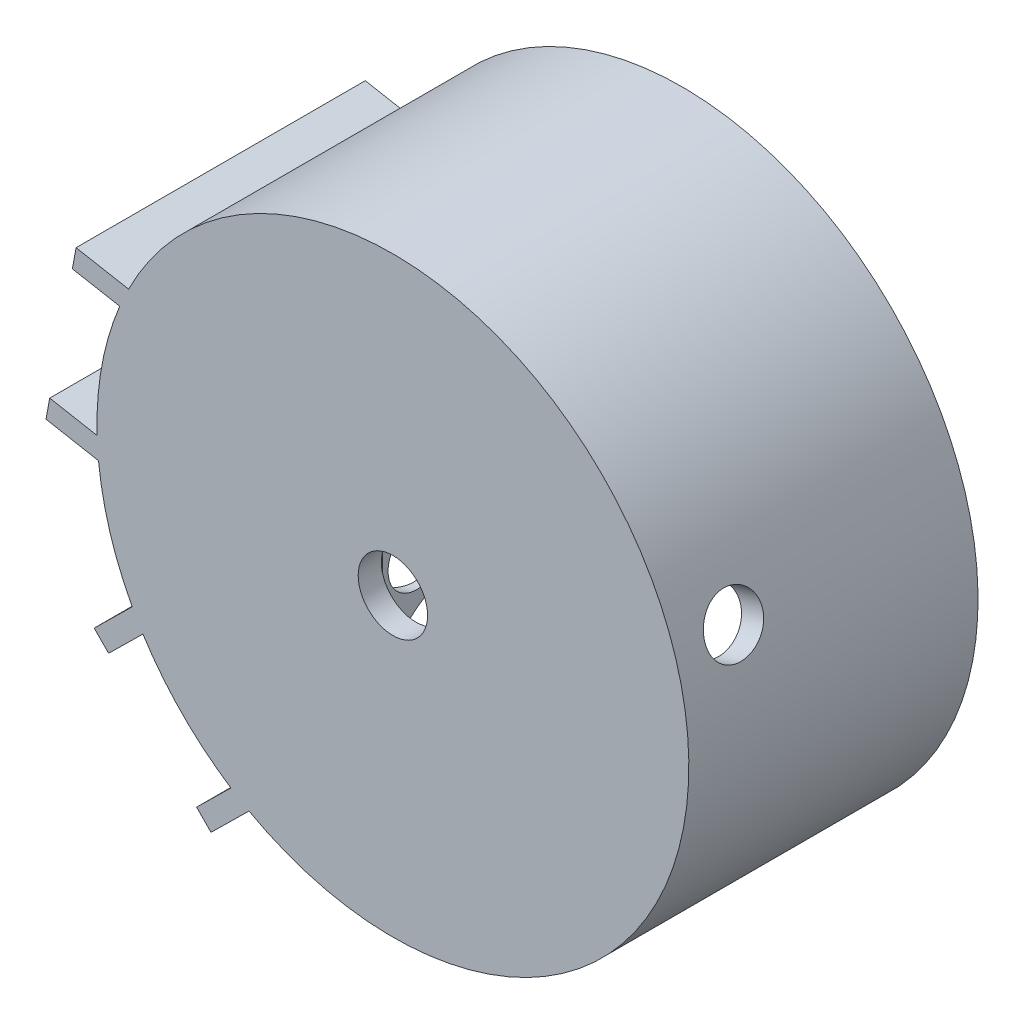
from build123d import *

# Parameters (mm, degrees)
SKETCH1_R                = 14.15
SKETCH1_R_2              = 1.8
BOSS_EXTRUDE1_DEPTH      = 1.2
BOSS_EXTRUDE2_START      = -15
SKETCH3_R                = 15.35
SKETCH3_R_2              = 14.15
BOSS_EXTRUDE2_DEPTH      = 15
CUT_EXTRUDE2_DEPTH       = 8
BOSS_EXTRUDE3_REACH      = 43.566
BOSS_EXTRUDE3_END_RADIUS = 15.35
SKETCH6_W                = 15
SKETCH6_H                = 1.064778235
CIRPATTERN1_COUNT        = 2
CIRPATTERN1_ANGLE        = 305
SKETCH7_R                = 2.75
SKETCH7_R_2              = 1.75
BOSS_EXTRUDE4_DEPTH      = 4
FILLET1_R                = 4
SKETCH8_W                = 3.5
SKETCH8_H                = 15.633258876
CUT_EXTRUDE3_DEPTH       = 4
SKETCH4_R                = 1.5
CUT_EXTRUDE1_DEPTH       = 37


with BuildPart() as part:
    # Sketch1 → Boss-Extrude1 (new body)
    with BuildSketch(Plane.XY):
        Circle(SKETCH1_R)
        Circle(SKETCH1_R_2, mode=Mode.SUBTRACT)
    extrude(amount=BOSS_EXTRUDE1_DEPTH)

    # Sketch3 → Boss-Extrude2 (add)
    with BuildSketch(Plane.XY.offset(1.2).offset(BOSS_EXTRUDE2_START)):
        Circle(SKETCH3_R)
        Circle(SKETCH3_R_2, mode=Mode.SUBTRACT)
    extrude(amount=BOSS_EXTRUDE2_DEPTH)

    # Sketch5 → Cut-Extrude2 (cut)
    with BuildSketch(Plane(origin=(0, 0, -13.8), x_dir=(-1, 0, 0), z_dir=(0, 0, -1))):
        with BuildLine():
            Line((14.252659556, 5.699490817), (13.047619315, 5.47559405))
            ThreePointArc((13.047619315, 5.47559405), (13.871667407, 2.792730446), (14.15, 0))
            ThreePointArc((14.15, 0), (14.148415567, -0.21174737), (14.143662622, -0.423447319))
            Line((14.143662622, -0.423447319), (15.348702863, -0.199550552))
            ThreePointArc((15.348702863, -0.199550552), (15.349675712, -0.099777384), (15.35, 0))
            ThreePointArc((15.35, 0), (15.073168615, 2.902083373), (14.252659556, 5.699490817))
        make_face()
        with BuildLine():
            ThreePointArc((12.000869192, -7.496775216), (10.138626321, -9.870701916), (7.815412549, -11.79583938))
            Line((7.815412549, -11.79583938), (8.693613767, -12.650833161))
            ThreePointArc((8.693613767, -12.650833161), (10.998439154, -10.707793245), (12.87907041, -8.351768997))
            Line((12.87907041, -8.351768997), (12.000869192, -7.496775216))
        make_face()
    extrude(amount=-CUT_EXTRUDE2_DEPTH, mode=Mode.SUBTRACT)

    # Boss-Extrude3: up to this cylinder (the profile starts outside it)
    boss_extrude3_end = Plane(origin=(0, 0, -6.3), z_dir=(0, 0, 1)) * Cylinder(BOSS_EXTRUDE3_END_RADIUS, 118.832, mode=Mode.PRIVATE)
    # Sketch6 → Boss-Extrude3 (add, up to the surface)
    with BuildSketch(Plane(origin=(-12.463353061, -12.28473974, 0), x_dir=(0, 0, 1), z_dir=(-0.7121916034988102, -0.7019851279804962, 0)), mode=Mode.PRIVATE) as boss_extrude3_sk1:
        with Locations((-6.3, -3.782389118)):
            Rectangle(SKETCH6_W, SKETCH6_H)
    boss_extrude3_tool1 = extrude(boss_extrude3_sk1.sketch, amount=-BOSS_EXTRUDE3_REACH, mode=Mode.PRIVATE) - boss_extrude3_end
    # Sketch6 → Boss-Extrude3 (add, up to the surface)
    with BuildSketch(Plane(origin=(-12.463353061, -12.28473974, 0), x_dir=(0, 0, 1), z_dir=(-0.7121916034988102, -0.7019851279804962, 0)), mode=Mode.PRIVATE) as boss_extrude3_sk2:
        with Locations((-6.3, 3.782389118)):
            Rectangle(SKETCH6_W, SKETCH6_H)
    boss_extrude3_tool2 = extrude(boss_extrude3_sk2.sketch, amount=-BOSS_EXTRUDE3_REACH, mode=Mode.PRIVATE) - boss_extrude3_end
    boss_extrude3 = boss_extrude3_tool1.solids().sort_by_distance((-9.808172, -14.978526, -6.3))[0] + boss_extrude3_tool2.solids().sort_by_distance((-15.118534, -9.590954, -6.3))[0]
    add(boss_extrude3)

    # CirPattern1: Boss-Extrude3 ×2 about axis
    cirpattern1_axis = Axis((0, 0, 0), (0, 0, 1))
    for i in range(1, CIRPATTERN1_COUNT):
        add(boss_extrude3.rotate(cirpattern1_axis, i * CIRPATTERN1_ANGLE / (CIRPATTERN1_COUNT - 1)))

    # Sketch7 → Boss-Extrude4 (add)
    with BuildSketch(Plane(origin=(0, 0, 0), x_dir=(-1, 0, 0), z_dir=(0, 0, -1))):
        with Locations(Location((0, 0, 0), (0, 0, 180))):
            Circle(SKETCH7_R)
        Circle(SKETCH7_R_2, mode=Mode.SUBTRACT)
    extrude(amount=BOSS_EXTRUDE4_DEPTH)

    # Fillet1
    fillet1_edges = [part.edges().sort_by_distance(p)[0] for p in [
        (-2.75, 0, 0),
    ]]
    fillet(fillet1_edges, radius=FILLET1_R - 0.0001)  # a hair under: the kernel refuses the full size

    # Sketch8 → Cut-Extrude3 (cut)
    with BuildSketch(Plane(origin=(0, 0, -4), x_dir=(-1, 0, 0), z_dir=(0, 0, -1))):
        Rectangle(SKETCH8_W, SKETCH8_H)
    extrude(amount=-CUT_EXTRUDE3_DEPTH, mode=Mode.SUBTRACT)

    # Sketch4 → Cut-Extrude1 (cut)
    with BuildSketch(Plane(origin=(-17.515032447, -2.63115554, 0), x_dir=(0.293814927975495, -0.9558623269586236, 0), z_dir=(0.9558623269586236, 0.293814927975495, 0))):
        with Locations((2.63115554, 1.8)):
            Circle(SKETCH4_R)
    extrude(amount=CUT_EXTRUDE1_DEPTH, mode=Mode.SUBTRACT)


solid = part.part
